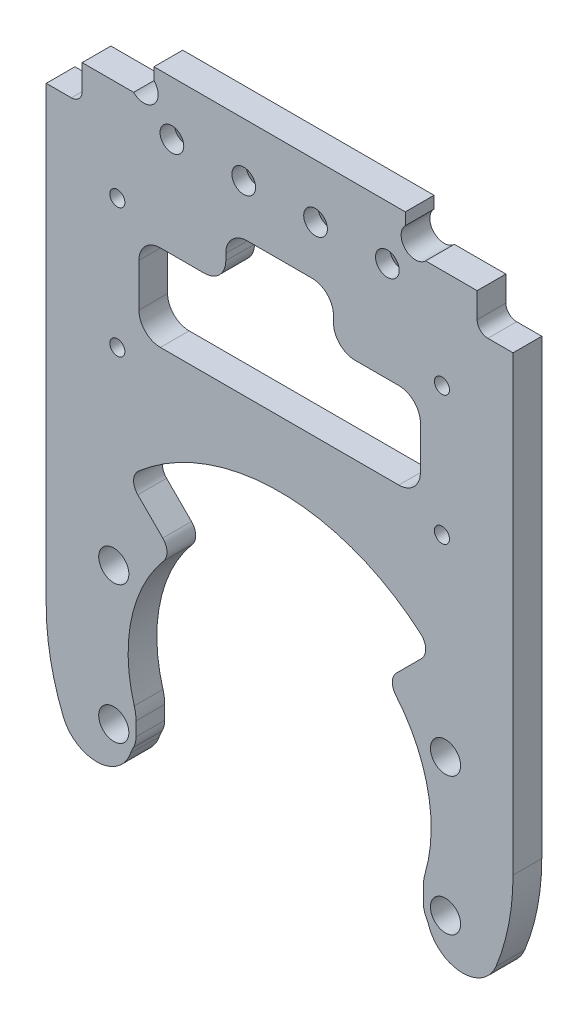
from build123d import *
from build123d.topology import SkipClean

# Parameters (mm, degrees)
EXTRUDE_1_DEPTH          = 4
CUT_EXTRUDE_1_DEPTH      = 87.442177205
CUT_EXTRUDE_1_DEPTH_BACK = 87.442177205
SKETCH_2_R               = 21.1
SKETCH_2_W               = 42.2
SKETCH_2_H               = 49.697757749
SKETCH_3_R               = 1.65
CUT_EXTRUDE_2_DEPTH      = 87.442177205
PATTERN_CIRCULAR_1_COUNT = 8
EXTRUDE_START            = -4
EXTRUDE_2_DEPTH          = 4
FILLET_1_R               = 6
CUT_EXTRUDE_3_DEPTH      = 87.442177205
CUT_EXTRUDE_3_DEPTH_BACK = 87.442177205
SKETCH_6_R               = 1.65
FILLET_2_R               = 2
CUT_EXTRUDE_4_DEPTH      = 87.442177205
SKETCH_8_R               = 2
CUT_EXTRUDE_5_DEPTH      = 80.551869871
CUT_EXTRUDE_6_DEPTH      = 80.551869871
CUT_EXTRUDE_6_DEPTH_BACK = 80.551869871
SKETCH_9_R               = 1.65
SKETCH_21_R              = 1.05
CUT_EXTRUDE_C620_DEPTH   = 182.304079666
CHAMFER_2_SIZE           = 2
FILLET_3_R               = 5
FILLET_4_R               = 5
CUT_EXTRUDE_7_DEPTH      = 80.551869871
CUT_EXTRUDE_7_DEPTH_BACK = 80.551869871
SKETCH_22_W              = 39.2
SKETCH_22_H              = 12
SKETCH_22_W_2            = 15
SKETCH_22_H_2            = 6.9
FILLET_5_R               = 3
CUT_EXTRUDE_8_DEPTH      = 80.551869871
CUT_EXTRUDE_8_DEPTH_BACK = 80.551869871
SKETCH_23_R              = 2.1
CUT_EXTRUDE_9_DEPTH      = 80.551869871
CUT_EXTRUDE_9_DEPTH_BACK = 80.551869871
SKETCH_24_W              = 5
SKETCH_24_H              = 5
FILLET_6_R               = 1.5


with BuildPart() as part:
    # 草图1 → 凸台-拉伸1 (new body)
    with BuildSketch(Plane.XY):
        with BuildLine():
            Line((32.5, 80), (-32.5, 80))
            Line((-32.5, 80), (-32.5, 0))
            ThreePointArc((-32.5, 0), (0, 32.5), (32.5, 0))
            Line((32.5, 0), (32.5, 80))
        make_face()
        with BuildLine():
            ThreePointArc((32.5, 0), (0, 32.5), (-32.5, 0))
            Line((-32.5, 0), (32.5, 0))
        make_face()
        with BuildLine():
            Line((32.5, 0), (-32.5, 0))
            ThreePointArc((-32.5, 0), (0, -32.5), (32.5, 0))
        make_face()
        with BuildLine():
            ThreePointArc((32.5, 0), (0, 32.5), (-32.5, 0))
            Line((-32.5, 0), (32.5, 0))
        make_face()
        with BuildLine():
            Line((32.5, 0), (-32.5, 0))
            ThreePointArc((-32.5, 0), (0, -32.5), (32.5, 0))
        make_face()
    extrude(amount=EXTRUDE_1_DEPTH)

    # 草图2 → 切除-拉伸1 (cut, two sides: drawn at the far end of the back side and taken through both)
    with BuildSketch(Plane.XY.offset(4).offset(-CUT_EXTRUDE_1_DEPTH_BACK)):
        Circle(SKETCH_2_R)
        with Locations((0, -24.848878875)):
            Rectangle(SKETCH_2_W, SKETCH_2_H)
    extrude(amount=CUT_EXTRUDE_1_DEPTH + CUT_EXTRUDE_1_DEPTH_BACK, mode=Mode.SUBTRACT)

    # 草图3 → 切除-拉伸2 (cut, symmetric)
    with BuildSketch(Plane.XY.offset(4)):
        with Locations((9.567085809, 23.096988313)):
            Circle(SKETCH_3_R)
    cut_extrude_2 = extrude(amount=CUT_EXTRUDE_2_DEPTH, both=True, mode=Mode.SUBTRACT)

    # 阵列(圆周)1: 切除-拉伸2 ×8 about axis
    pattern_circular_1_axis = Axis((0, 0, 0), (0, 0, 1))
    for i in range(1, PATTERN_CIRCULAR_1_COUNT):
        add(cut_extrude_2.rotate(pattern_circular_1_axis, i * 360 / PATTERN_CIRCULAR_1_COUNT), mode=Mode.SUBTRACT)

    # 草图4 → 凸台-拉伸2 (add)
    with SkipClean():  # the faces are left unmerged after this step: merging them gives an invalid solid
        with BuildSketch(Plane.XY.offset(4).offset(EXTRUDE_START)):
            with BuildLine():
                ThreePointArc((-21.1, -11.934230563), (-20.288431203, -10.872207862), (-20, -9.567085809))
                Line((-20, -9.567085809), (-20, -6.72383819))
                ThreePointArc((-20, -6.72383819), (-20.823184195, -3.406611219), (-21.1, 0))
                Line((-21.1, 0), (-21.1, -11.934230563))
            make_face()
            with BuildLine():
                ThreePointArc((21.1, 0), (20.823184195, -3.406611219), (20, -6.72383819))
                Line((20, -6.72383819), (20, -9.567085809))
                ThreePointArc((20, -9.567085809), (20.288431203, -10.872207862), (21.1, -11.934230563))
                Line((21.1, -11.934230563), (21.1, 0))
            make_face()
        extrude(amount=EXTRUDE_2_DEPTH)

    # 圆角1
    fillet_1_edges = [part.edges().sort_by_distance(p)[0] for p in [
        (21.1, -11.934230563, 2),
        (20, -6.72383819, 2),
        (-21.1, -11.934230563, 2),
        (-20, -6.72383819, 2),
    ]]
    fillet(fillet_1_edges, radius=FILLET_1_R)

    # 草图6 → 切除-拉伸3 (cut, two sides: drawn at the far end of the back side and taken through both)
    # profile 1 of 4: a face of its own
    with SkipClean():  # the faces are left unmerged after this step: merging them gives an invalid solid
        with BuildSketch(Plane.XY.offset(4).offset(-CUT_EXTRUDE_3_DEPTH_BACK)):
            with BuildLine():
                Line((0, 30), (0, 21.1))
                ThreePointArc((0, 21.1), (8.074620423, 19.493858136), (14.919953083, 14.919953083))
                Line((14.919953083, 14.919953083), (21.213203436, 21.213203436))
                ThreePointArc((21.213203436, 21.213203436), (11.480502971, 27.716385975), (0, 30))
            make_face()
            with Locations((9.567085809, 23.096988313)):
                Circle(SKETCH_6_R, mode=Mode.SUBTRACT)
        # profile 2 of 4: a face of its own
        with BuildSketch(Plane.XY.offset(4).offset(-CUT_EXTRUDE_3_DEPTH_BACK)):
            with BuildLine():
                ThreePointArc((-14.919953083, 14.919953083), (-8.074620423, 19.493858136), (0, 21.1))
                Line((0, 21.1), (0, 30))
                ThreePointArc((0, 30), (-11.480502971, 27.716385975), (-21.213203436, 21.213203436))
                Line((-21.213203436, 21.213203436), (-14.919953083, 14.919953083))
            make_face()
            with Locations((-9.567085809, 23.096988313)):
                Circle(SKETCH_6_R, mode=Mode.SUBTRACT)
        # profile 3 of 4: a face of its own
        with BuildSketch(Plane.XY.offset(4).offset(-CUT_EXTRUDE_3_DEPTH_BACK)):
            with BuildLine():
                Line((-14.919953083, 14.919953083), (0, 0))
                Line((0, 0), (0, 21.1))
                ThreePointArc((0, 21.1), (-8.074620423, 19.493858136), (-14.919953083, 14.919953083))
            make_face()
        # profile 4 of 4: a face of its own
        with BuildSketch(Plane.XY.offset(4).offset(-CUT_EXTRUDE_3_DEPTH_BACK)):
            with BuildLine():
                Line((0, 21.1), (0, 0))
                Line((0, 0), (14.919953083, 14.919953083))
                ThreePointArc((14.919953083, 14.919953083), (8.074620423, 19.493858136), (0, 21.1))
            make_face()
        extrude(amount=CUT_EXTRUDE_3_DEPTH + CUT_EXTRUDE_3_DEPTH_BACK, mode=Mode.SUBTRACT)

    # 圆角2
    fillet_2_edges = [part.edges().sort_by_distance(p)[0] for p in [
        (-14.919953083, 14.919953083, 2),
        (14.919953083, 14.919953083, 2),
        (21.213203436, 21.213203436, 2),
        (-21.213203436, 21.213203436, 2),
    ]]
    fillet(fillet_2_edges, radius=FILLET_2_R)

    # 草图7 → 切除-拉伸4 (cut, through all)
    with SkipClean():  # the faces are left unmerged after this step: merging them gives an invalid solid
        with BuildSketch(Plane.XY.offset(4)):
            Polygon((-32.5, 80), (-32.5, 68), (-17.5, 68), (-17.5, 72.5), (17.5, 72.5), (17.5, 68), (32.5, 68), (32.5, 80), align=None)
        extrude(amount=-CUT_EXTRUDE_4_DEPTH, mode=Mode.SUBTRACT)

    # 草图8 → 切除-拉伸5 (cut, through all)
    with SkipClean():  # the faces are left unmerged after this step: merging them gives an invalid solid
        with BuildSketch(Plane.XY.offset(4)):
            with Locations((-18.914213562, 69.414213562)):
                Circle(SKETCH_8_R)
            with Locations((18.914213562, 69.414213562)):
                Circle(SKETCH_8_R)
        extrude(amount=-CUT_EXTRUDE_5_DEPTH, mode=Mode.SUBTRACT)

    # 草图9 → 切除-拉伸6 (cut, two sides: drawn at the far end of the back side and taken through both)
    with SkipClean():  # the faces are left unmerged after this step: merging them gives an invalid solid
        with BuildSketch(Plane.XY.offset(4).offset(-CUT_EXTRUDE_6_DEPTH_BACK)):
            with Locations((5, 65)):
                Circle(SKETCH_9_R)
            with Locations((15, 65)):
                Circle(SKETCH_9_R)
            with Locations((-5, 65)):
                Circle(SKETCH_9_R)
            with Locations((-15, 65)):
                Circle(SKETCH_9_R)
        extrude(amount=CUT_EXTRUDE_6_DEPTH + CUT_EXTRUDE_6_DEPTH_BACK, mode=Mode.SUBTRACT)

    # 草图21 → C620孔位 (cut, through all)
    with SkipClean():  # the faces are left unmerged after this step: merging them gives an invalid solid
        with BuildSketch(Plane(origin=(-123.742438545, -19.388354545, 4), x_dir=(1, 0, 0), z_dir=(0, 0, 1))):
            with Locations((146.342438545, 55.488354545)):
                Circle(SKETCH_21_R)
            with Locations((101.142438545, 55.488354545)):
                Circle(SKETCH_21_R)
            with Locations((101.142438545, 73.488354545)):
                Circle(SKETCH_21_R)
            with Locations((146.342438545, 73.488354545)):
                Circle(SKETCH_21_R)
        extrude(amount=-CUT_EXTRUDE_C620_DEPTH, mode=Mode.SUBTRACT)

    # 倒角2
    chamfer_2_edges = [part.edges().sort_by_distance(p)[0] for p in [
        (-16.65, 65, 0),
        (-6.65, 65, 0),
        (13.35, 65, 0),
        (3.35, 65, 0),
    ]]
    chamfer(chamfer_2_edges, length=CHAMFER_2_SIZE)

    # 圆角3
    # the kernel refuses this fillet: 5 mm, written as the material it takes off along each edge
    with BuildSketch(Plane(origin=(21.1, -24.719223289, 42.630367083), x_dir=(-0.025798763537540494, 0.9996671565075718, 0), z_dir=(0, 0, -1))) as fillet_3_piece_1:
        with BuildLine():
            CenterArc((14.294133967, 4.765806115), FILLET_3_R, 113.490040764, 138.904380638)
            Line((12.301185676, 9.351452974), (12.101890847, 9.81001766))
            ThreePointArc((12.101890847, 9.81001766), (5.284147412, 5.815475154), (-0.388543839, 0.314696179))
            Line((-0.388543839, 0.314696179), (0.012899382, -0.499833578))
            ThreePointArc((0.012899382, -0.499833578), (10.825151105, -0.220797978), (12.630589135, -0.476580612))
            Line((12.630589135, -0.476580612), (12.781820484, 0))
        make_face()
    extrude(amount=81.260734166, mode=Mode.SUBTRACT)

    # 圆角4
    # the kernel refuses this fillet: 5 mm, written as the material it takes off along each edge
    with BuildSketch(Plane(origin=(-21.1, -24.719223289, 42.630367083), x_dir=(0.025798763537535546, 0.999667156507572, 0), z_dir=(0, 0, -1))) as fillet_4_piece_1:
        with BuildLine():
            CenterArc((14.294133967, -4.765806115), FILLET_4_R, 107.605578598, 138.904380638)
            Line((12.301185676, -9.351452974), (12.101890847, -9.81001766))
            ThreePointArc((12.101890847, -9.81001766), (5.284147412, -5.815475154), (-0.388543839, -0.314696179))
            Line((-0.388543839, -0.314696179), (0.012899382, 0.499833578))
            ThreePointArc((0.012899382, 0.499833578), (10.825151105, 0.220797978), (12.630589135, 0.476580612))
            Line((12.630589135, 0.476580612), (12.781820484, 0))
        make_face()
    extrude(amount=81.260734166, mode=Mode.SUBTRACT)

    # 草图22 → 切除-拉伸7 (cut, two sides: drawn at the far end of the back side and taken through both)
    with SkipClean():  # the faces are left unmerged after this step: merging them gives an invalid solid
        with BuildSketch(Plane.XY.offset(4).offset(-CUT_EXTRUDE_7_DEPTH_BACK)):
            with Locations((0, 45.1)):
                Rectangle(SKETCH_22_W, SKETCH_22_H)
            with Locations((0, 54.55)):
                Rectangle(SKETCH_22_W_2, SKETCH_22_H_2)
        extrude(amount=CUT_EXTRUDE_7_DEPTH + CUT_EXTRUDE_7_DEPTH_BACK, mode=Mode.SUBTRACT)

    # 圆角5
    fillet_5_edges = [part.edges().sort_by_distance(p)[0] for p in [
        (-19.6, 51.1, 2),
        (-7.5, 51.1, 2),
        (-7.5, 58, 2),
        (7.5, 58, 2),
        (7.5, 51.1, 2),
        (19.6, 51.1, 2),
        (19.6, 39.1, 2),
        (-19.6, 39.1, 2),
    ]]
    fillet(fillet_5_edges, radius=FILLET_5_R)

    # 草图23 → 切除-拉伸8 (cut, two sides: drawn at the far end of the back side and taken through both)
    with SkipClean():  # the faces are left unmerged after this step: merging them gives an invalid solid
        with BuildSketch(Plane.XY.offset(4).offset(-CUT_EXTRUDE_8_DEPTH_BACK)):
            with Locations((23.096988313, 9.567085809)):
                Circle(SKETCH_23_R)
            with Locations((23.096988313, -9.567085809)):
                Circle(SKETCH_23_R)
            with Locations((-23.096988313, 9.567085809)):
                Circle(SKETCH_23_R)
            with Locations((-23.096988313, -9.567085809)):
                Circle(SKETCH_23_R)
        extrude(amount=CUT_EXTRUDE_8_DEPTH + CUT_EXTRUDE_8_DEPTH_BACK, mode=Mode.SUBTRACT)

    # 草图24 → 切除-拉伸9 (cut, two sides: drawn at the far end of the back side and taken through both)
    with SkipClean():  # the faces are left unmerged after this step: merging them gives an invalid solid
        with BuildSketch(Plane(origin=(0, 0, 0), x_dir=(-1, 0, 0), z_dir=(0, 0, -1)).offset(-CUT_EXTRUDE_9_DEPTH_BACK)):
            with Locations((30, 65.5)):
                Rectangle(SKETCH_24_W, SKETCH_24_H)
            with Locations((-30, 65.5)):
                Rectangle(SKETCH_24_W, SKETCH_24_H)
        extrude(amount=CUT_EXTRUDE_9_DEPTH + CUT_EXTRUDE_9_DEPTH_BACK, mode=Mode.SUBTRACT)

    # 圆角6
    fillet_6_edges = [part.edges().sort_by_distance(p)[0] for p in [
        (-27.5, 63, 2),
        (27.5, 63, 2),
    ]]
    fillet(fillet_6_edges, radius=FILLET_6_R)


solid = part.part
